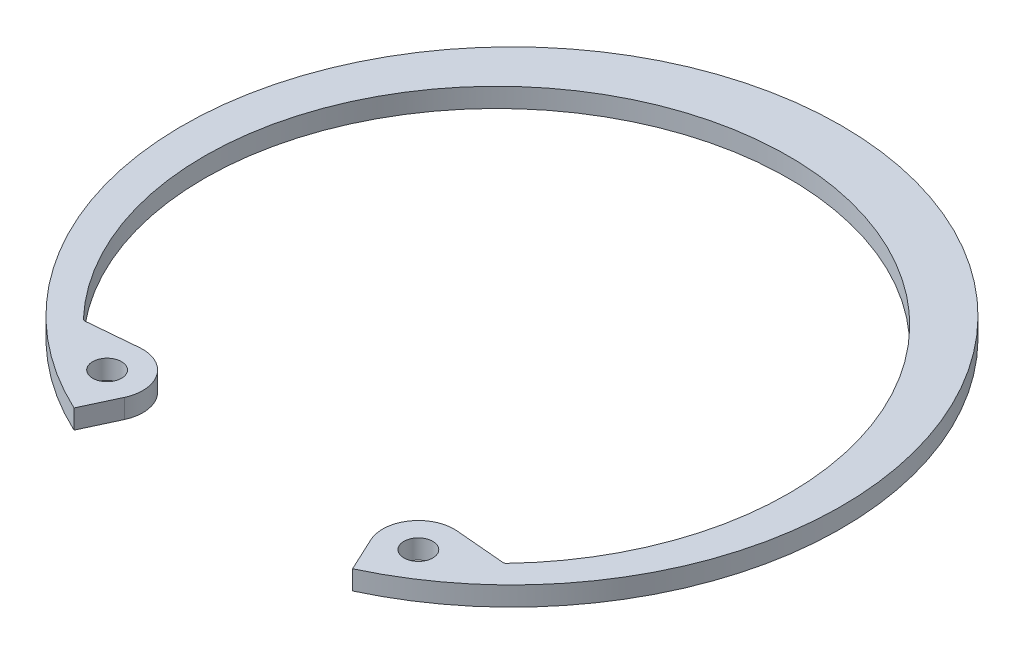
from build123d import *

# Parameters (mm, degrees)
SKETCH2_R      = 1.1811
EXTRUDE1_DEPTH = 1.5748
FILLET1_R      = 0.254


with BuildPart() as part:
    # Sketch2 → Extrude1 (new body)
    with BuildSketch(Plane(origin=(0, 0, 0), x_dir=(1, 0, 0), z_dir=(0, 1, 0))):
        with BuildLine():
            Line((11.389308583, -24.424451076), (10.079527634, -21.615616767))
            ThreePointArc((10.079527634, -21.615616767), (10.334109559, -18.705732054), (12.981434605, -17.471264112))
            Line((12.981434605, -17.471264112), (17.211887304, -17.841380764))
            ThreePointArc((17.211887304, -17.841380764), (0, 22.6314), (-17.211887304, -17.841380764))
            Line((-17.211887304, -17.841380764), (-12.981434605, -17.471264112))
            ThreePointArc((-12.981434605, -17.471264112), (-10.334109559, -18.705732054), (-10.079527634, -21.615616767))
            Line((-10.079527634, -21.615616767), (-11.389308583, -24.424451076))
            ThreePointArc((-11.389308583, -24.424451076), (0, 26.9494), (11.389308583, -24.424451076))
        make_face()
        with Locations((12.72685268, -20.381148825)):
            Circle(SKETCH2_R, mode=Mode.SUBTRACT)
        with Locations((-12.72685268, -20.381148825)):
            Circle(SKETCH2_R, mode=Mode.SUBTRACT)
    extrude(amount=-EXTRUDE1_DEPTH)

    # Fillet1
    fillet1_edges = [part.edges().sort_by_distance(p)[0] for p in [
        (-17.211887304, -0.7874, 17.841380764),
        (17.211887304, -0.7874, 17.841380764),
    ]]
    fillet(fillet1_edges, radius=FILLET1_R)


solid = part.part
